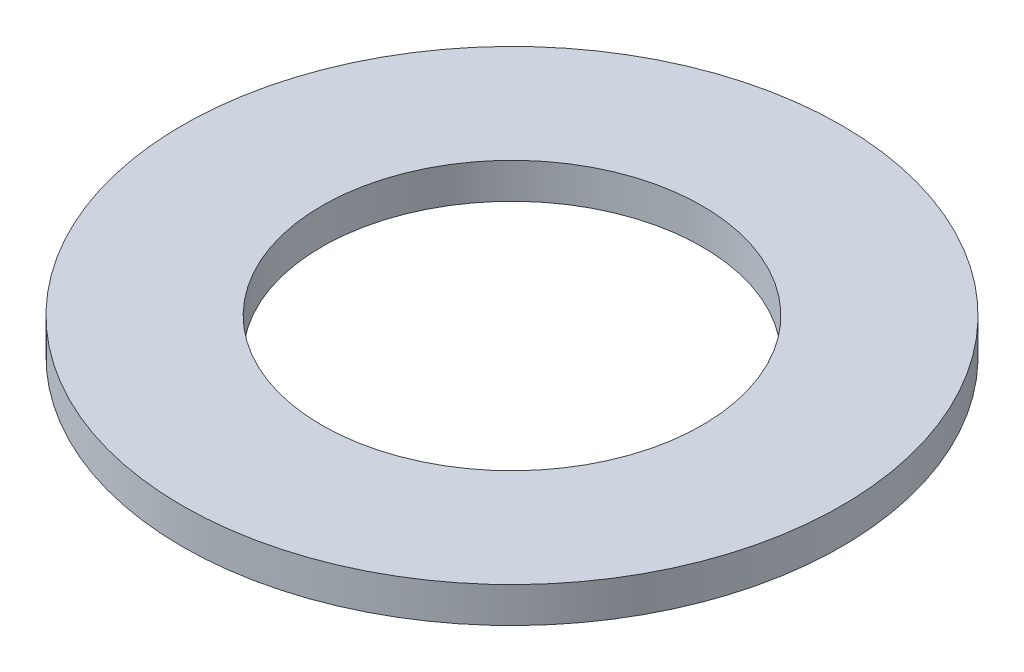
from build123d import *

# Parameters (mm, degrees)
SKETCH1_R           = 65
BOSS_EXTRUDE1_DEPTH = 7
SKETCH2_R           = 37.5
CUT_EXTRUDE1_DEPTH  = 93.190021152


with BuildPart() as part:
    # Sketch1 → Boss-Extrude1 (new body)
    with BuildSketch(Plane(origin=(0, 0, 0), x_dir=(1, 0, 0), z_dir=(0, 1, 0))):
        Circle(SKETCH1_R)
    extrude(amount=BOSS_EXTRUDE1_DEPTH)

    # Sketch2 → Cut-Extrude1 (cut, through all)
    with BuildSketch(Plane(origin=(0, 0, 0), x_dir=(1, 0, 0), z_dir=(0, 1, 0))):
        Circle(SKETCH2_R)
    extrude(amount=CUT_EXTRUDE1_DEPTH, mode=Mode.SUBTRACT)


solid = part.part
